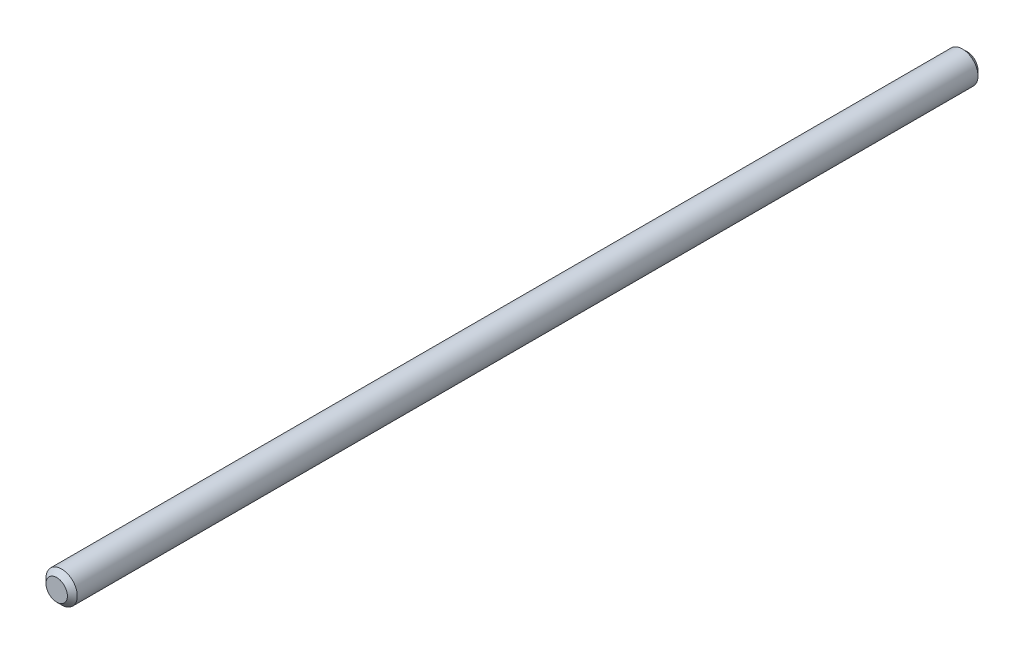
from build123d import *

# Parameters (mm, degrees)
SKETCH1_R           = 3.175
BOSS_EXTRUDE1_DEPTH = 185
CHAMFER1_SIZE       = 1


with BuildPart() as part:
    # Sketch1 → Boss-Extrude1 (new body)
    with BuildSketch(Plane.XY):
        Circle(SKETCH1_R)
    extrude(amount=-BOSS_EXTRUDE1_DEPTH)

    # Chamfer1
    chamfer1_edges = [part.edges().sort_by_distance(p)[0] for p in [
        (-3.175, 0, -185),
        (-3.175, 0, 0),
    ]]
    chamfer(chamfer1_edges, length=CHAMFER1_SIZE)


solid = part.part
